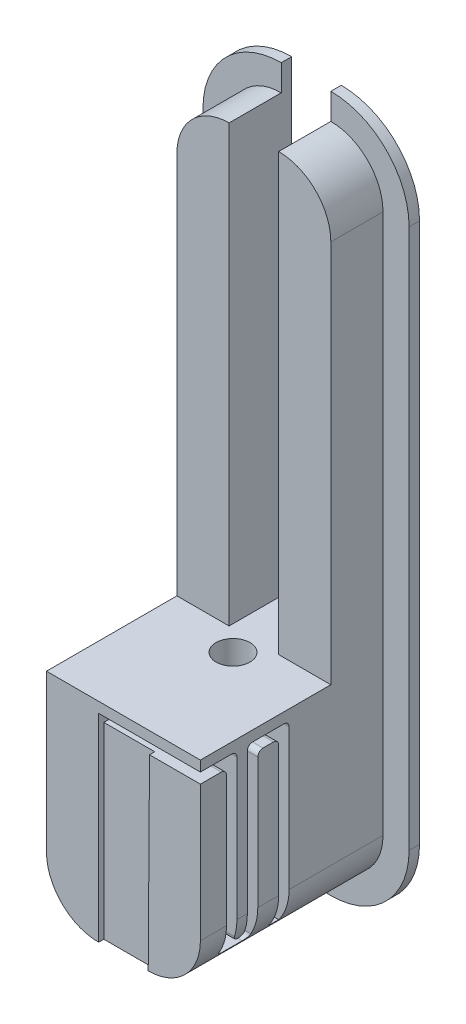
from build123d import *

# Parameters (mm, degrees)
BOSS_EXTRUDE1_DEPTH          = 10
BOSS_EXTRUDE2_DEPTH          = 25
CUT_EXTRUDE_THIN1_DEPTH      = 77.865548199
CUT_EXTRUDE_THIN1_DEPTH_BACK = 19.5
SKETCH5_W                    = 9.5
SKETCH5_H                    = 83.5
CUT_EXTRUDE1_DEPTH           = 25
FILLET2_R                    = 1
SKETCH8_R                    = 3.25
CUT_EXTRUDE2_DEPTH           = 54
CUT_EXTRUDE3_DEPTH           = 30
BOSS_EXTRUDE5_START          = 2
BOSS_EXTRUDE5_DEPTH          = 2
BOSS_EXTRUDE6_DEPTH          = 1


with BuildPart() as part:
    # Sketch1 → Boss-Extrude1 (new body)
    with BuildSketch(Plane.XY):
        with BuildLine():
            Line((-4.75, -61.75), (4.75, -61.75))
            ThreePointArc((4.75, -61.75), (11.821067812, -58.821067812), (14.75, -51.75))
            Line((14.75, -51.75), (14.75, 51.75))
            ThreePointArc((14.75, 51.75), (11.821067812, 58.821067812), (4.75, 61.75))
            Line((4.75, 61.75), (-4.75, 61.75))
            ThreePointArc((-4.75, 61.75), (-11.821067812, 58.821067812), (-14.75, 51.75))
            Line((-14.75, 51.75), (-14.75, -51.75))
            ThreePointArc((-14.75, -51.75), (-11.821067812, -58.821067812), (-4.75, -61.75))
        make_face()
    extrude(amount=BOSS_EXTRUDE1_DEPTH)

    # Sketch3 → Boss-Extrude2 (add)
    with BuildSketch(Plane.XY.offset(10)):
        with BuildLine():
            Line((14.75, -51.75), (14.75, -21.75))
            Line((14.75, -21.75), (-14.75, -21.75))
            Line((-14.75, -21.75), (-14.75, -51.75))
            ThreePointArc((-14.75, -51.75), (-11.821067812, -58.821067812), (-4.75, -61.75))
            Line((-4.75, -61.75), (4.75, -61.75))
            ThreePointArc((4.75, -61.75), (11.821067812, -58.821067812), (14.75, -51.75))
        make_face()
    extrude(amount=BOSS_EXTRUDE2_DEPTH)

    # Sketch4 → Cut-Extrude-Thin1 (cut, two sides: drawn at the far end of the back side and taken through both)
    with BuildSketch(Plane(origin=(14.75, 0, 0), x_dir=(0, 0, -1), z_dir=(1, 0, 0)).offset(-CUT_EXTRUDE_THIN1_DEPTH_BACK)):
        Polygon((-34, -74.39853969), (-34, -25.75), (-30, -25.75), (-30, -57.75), (-24, -57.75), (-24, -25.75), (-20, -25.75), (-20, -57.75), (-18, -57.75), (-18, -23.75), (-26, -23.75), (-26, -55.75), (-28, -55.75), (-28, -23.75), (-36, -23.75), (-36, -74.39853969), align=None)
    extrude(amount=CUT_EXTRUDE_THIN1_DEPTH + CUT_EXTRUDE_THIN1_DEPTH_BACK, mode=Mode.SUBTRACT)

    # Sketch5 → Cut-Extrude1 (cut)
    with BuildSketch(Plane(origin=(0, 0, 0), x_dir=(-1, 0, 0), z_dir=(0, 0, -1))):
        with Locations((0, 20)):
            Rectangle(SKETCH5_W, SKETCH5_H)
    extrude(amount=-CUT_EXTRUDE1_DEPTH, mode=Mode.SUBTRACT)

    # Fillet2
    fillet2_edges = [part.edges().sort_by_distance(p)[0] for p in [
        (5, -25.75, 24),
        (4, -57.75, 30),
        (4, -57.75, 24),
        (5, -25.75, 20),
        (5, -23.75, 18),
        (5, -23.75, 28),
        (5, -23.75, 26),
        (4.582575695, -55.75, 26),
        (4.582575695, -55.75, 28),
        (5, -25.75, 30),
    ]]
    fillet(fillet2_edges, radius=FILLET2_R - 0.0001)  # a hair under: the kernel refuses the full size

    # Sketch8 → Cut-Extrude2 (cut)
    with BuildSketch(Plane(origin=(0, -21.75, 0), x_dir=(1, 0, 0), z_dir=(0, 1, 0))):
        with Locations(Location((0, -14, 0), (0, 0, 180))):
            Circle(SKETCH8_R)
    extrude(amount=-CUT_EXTRUDE2_DEPTH, mode=Mode.SUBTRACT)

    # Sketch9 → Cut-Extrude3 (cut)
    with BuildSketch(Plane(origin=(0, -61.75, 0), x_dir=(-1, 0, 0), z_dir=(0, -1, 0))):
        Polygon((0, -9.381197846), (-4, -11.690598923), (-4, -16.309401077), (0, -18.618802154), (4, -16.309401077), (4, -11.690598923), align=None)
    extrude(amount=-CUT_EXTRUDE3_DEPTH, mode=Mode.SUBTRACT)

    # Sketch11 → Boss-Extrude5 (add)
    with BuildSketch(Plane(origin=(0, 0, 0), x_dir=(-1, 0, 0), z_dir=(0, 0, -1)).offset(BOSS_EXTRUDE5_START)):
        with BuildLine():
            Line((-4.75, -66.75), (4.75, -66.75))
            ThreePointArc((4.75, -66.75), (15.356601718, -62.356601718), (19.75, -51.75))
            Line((19.75, -51.75), (19.75, 51.75))
            ThreePointArc((19.75, 51.75), (15.356601718, 62.356601718), (4.75, 66.75))
            Line((4.75, 66.75), (4.75, 61.75))
            ThreePointArc((4.75, 61.75), (11.821067812, 58.821067812), (14.75, 51.75))
            Line((14.75, 51.75), (14.75, -51.75))
            ThreePointArc((14.75, -51.75), (11.821067812, -58.821067812), (4.75, -61.75))
            Line((4.75, -61.75), (-4.75, -61.75))
            ThreePointArc((-4.75, -61.75), (-11.821067812, -58.821067812), (-14.75, -51.75))
            Line((-14.75, -51.75), (-14.75, 51.75))
            ThreePointArc((-14.75, 51.75), (-11.821067812, 58.821067812), (-4.75, 61.75))
            Line((-4.75, 61.75), (-4.75, 66.75))
            ThreePointArc((-4.75, 66.75), (-15.356601718, 62.356601718), (-19.75, 51.75))
            Line((-19.75, 51.75), (-19.75, -51.75))
            ThreePointArc((-19.75, -51.75), (-15.356601718, -62.356601718), (-4.75, -66.75))
        make_face()
        with BuildLine():
            ThreePointArc((14.75, 51.75), (11.821067812, 58.821067812), (4.75, 61.75))
            Line((4.75, 61.75), (4.75, -21.75))
            Line((4.75, -21.75), (-4.75, -21.75))
            Line((-4.75, -21.75), (-4.75, 61.75))
            ThreePointArc((-4.75, 61.75), (-11.821067812, 58.821067812), (-14.75, 51.75))
            Line((-14.75, 51.75), (-14.75, -51.75))
            ThreePointArc((-14.75, -51.75), (-11.821067812, -58.821067812), (-4.75, -61.75))
            Line((-4.75, -61.75), (4.75, -61.75))
            ThreePointArc((4.75, -61.75), (11.821067812, -58.821067812), (14.75, -51.75))
            Line((14.75, -51.75), (14.75, 51.75))
        make_face()
    extrude(amount=-BOSS_EXTRUDE5_DEPTH)

    # Sketch12 → Boss-Extrude6 (add)
    with BuildSketch(Plane.XY.offset(34)):
        with BuildLine():
            Line((5, -25.75), (4.75, -61.75))
            ThreePointArc((4.75, -61.75), (11.821067812, -58.821067812), (14.75, -51.75))
            Line((14.75, -51.75), (14.75, -25.75))
            Line((14.75, -25.75), (5, -25.75))
        make_face()
    extrude(amount=BOSS_EXTRUDE6_DEPTH)


solid = part.part
